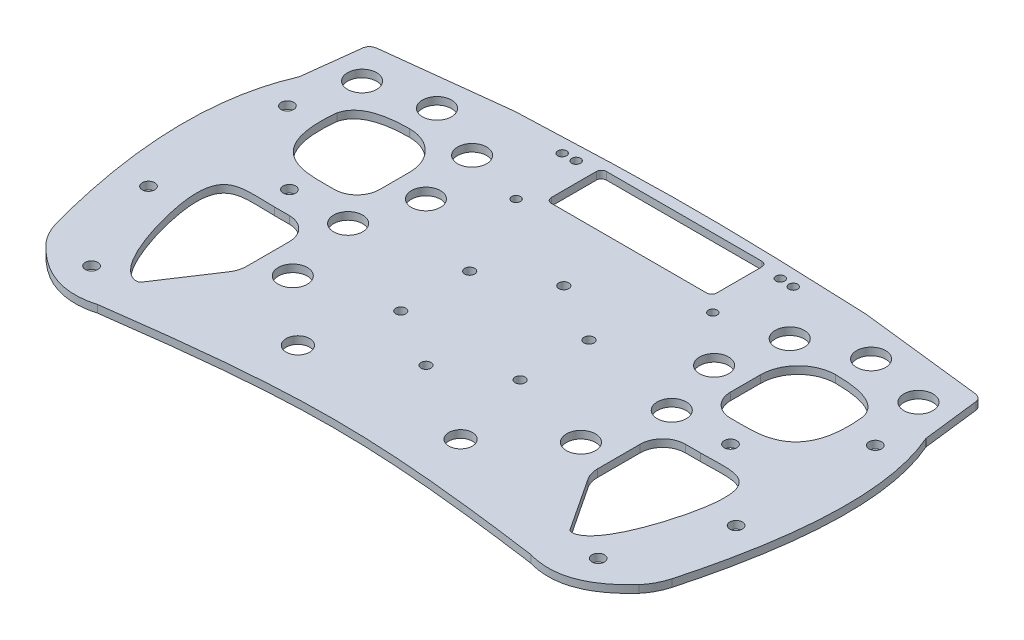
from build123d import *

# Parameters (mm, degrees)
BOSS_EXTRUDE1_OUTLINE_R   = 2.5
BOSS_EXTRUDE1_OUTLINE_R_2 = 4.7
BOSS_EXTRUDE1_OUTLINE_R_3 = 5.8
BOSS_EXTRUDE1_OUTLINE_R_4 = 2
BOSS_EXTRUDE1_DEPTH       = 3
SKETCH3_R                 = 1.5
CUT_EXTRUDE1_DEPTH        = 2
SKETCH5_W                 = 62
SKETCH5_H                 = 18
SKETCH5_W_2               = 2
SKETCH5_H_2               = 2
CUT_EXTRUDE4_DEPTH        = 3
SKETCH6_R                 = 1.75
CUT_EXTRUDE5_DEPTH        = 3


# Read off the part's stored shape, not the designer's step: Boss-Extrude1
with BuildPart() as part:
    # Boss-Extrude1 outline → Boss-Extrude1 (new body)
    with BuildSketch(Plane(origin=(0, 0, 0), x_dir=(1, 0, 0), z_dir=(0, 1, 0))):
        with BuildLine():
            Line((-70, 78), (-119.123426788, 72.331912294))
            add(Edge.make_bspline(
                [(-119.123426788, 72.331912294), (-121.817313074, 72.000000019), (-122.273896674, 69.717527721)],
                knots=[0.016356922, 0.016356922, 0.016356922, 0.873306336, 0.873306336, 0.873306336], degree=2))
            Line((-122.273896674, 69.717527721), (-125, 47))
            add(Edge.make_bspline(
                [(-125, 47), (-140.310843166, 12.049240253), (-122.843906966, -52.183993971)],
                knots=[0, 0, 0, 0.96415889, 0.96415889, 0.96415889], degree=2))
            add(Edge.make_bspline(
                [(-122.843906966, -52.183993971), (-121.5, -57), (-118.282004102, -60.826813609)],
                knots=[0, 0, 0, 1, 1, 1], degree=2))
            add(Edge.make_bspline(
                [(-118.282004102, -60.826813609), (-103.606996493, -76.952025301), (-86.5, -72)],
                knots=[0.099631764, 0.099631764, 0.099631764, 1, 1, 1], degree=2))
            add(Edge.make_bspline(
                [(-86.5, -72), (0, -60), (86.5, -72)],
                knots=[0, 0, 0, 1, 1, 1], degree=2, weights=[1, 1.666666667, 1]))
            add(Edge.make_bspline(
                [(118.282004106, -60.826813605), (103.606996495, -76.952025301), (86.5, -72)],
                knots=[0.099631763, 0.099631763, 0.099631763, 1, 1, 1], degree=2))
            add(Edge.make_bspline(
                [(122.843906966, -52.183993971), (121.5, -57), (118.282004106, -60.826813605)],
                knots=[0, 0, 0, 1, 1, 1], degree=2))
            add(Edge.make_bspline(
                [(125, 47), (140.310843171, 12.049240242), (122.843906966, -52.183993971)],
                knots=[0, 0, 0, 0.96415889, 0.96415889, 0.96415889], degree=2))
            Line((125, 47), (122.273896674, 69.717527721))
            add(Edge.make_bspline(
                [(119.123426788, 72.331912294), (121.817313074, 72.000000019), (122.273896674, 69.717527721)],
                knots=[0.016356922, 0.016356922, 0.016356922, 0.873306336, 0.873306336, 0.873306336], degree=2))
            Line((119.123426788, 72.331912294), (70, 78))
            add(Edge.make_bspline(
                [(-70, 78), (0, 81), (70, 78)],
                knots=[0, 0, 0, 1, 1, 1], degree=2, weights=[1, 1.857142857, 1]))
        make_face()
        with Locations((-101.086868344, -59.874042945)):
            Circle(BOSS_EXTRUDE1_OUTLINE_R, mode=Mode.SUBTRACT)
        with Locations((-32.460031949, -46.153127094)):
            Circle(BOSS_EXTRUDE1_OUTLINE_R_2, mode=Mode.SUBTRACT)
        with Locations((-117.25, -21)):
            Circle(BOSS_EXTRUDE1_OUTLINE_R, mode=Mode.SUBTRACT)
        with BuildLine():
            Line((-70, -12), (-70, -29))
            add(Edge.make_bspline(
                [(-70, -29), (-70, -31.999987298), (-71.652526625, -34.50382822)],
                knots=[0, 0, 0, 1, 1, 1], degree=2))
            Line((-71.652526625, -34.50382822), (-85.673736688, -55.74808589))
            add(Edge.make_bspline(
                [(-85, -3), (-99, -3), (-112, 0), (-108, -8.5), (-105, -31), (-98, -49), (-94.5, -57), (-86.500030089, -57), (-85.673736688, -55.74808589)],
                knots=[0, 0, 0, 0, 0, 0, 0, 0, 0, 1, 1, 1, 1, 1, 1, 1, 1, 1], degree=8))
            Line((-85, -3), (-79, -3))
            ThreePointArc((-79, -3), (-72.636038969, -5.636038969), (-70, -12))
        make_face(mode=Mode.SUBTRACT)
        with Locations((-57.5, -23.153127094)):
            Circle(BOSS_EXTRUDE1_OUTLINE_R_3, mode=Mode.SUBTRACT)
        with Locations((0, -27.5)):
            Circle(BOSS_EXTRUDE1_OUTLINE_R_4, mode=Mode.SUBTRACT)
        with Locations((-23.815698604, -13.75)):
            Circle(BOSS_EXTRUDE1_OUTLINE_R_4, mode=Mode.SUBTRACT)
        with Locations((32.460031949, -46.153127094)):
            Circle(BOSS_EXTRUDE1_OUTLINE_R_2, mode=Mode.SUBTRACT)
        with Locations((101.086868344, -59.874042945)):
            Circle(BOSS_EXTRUDE1_OUTLINE_R, mode=Mode.SUBTRACT)
        with Locations((57.5, -23.153127094)):
            Circle(BOSS_EXTRUDE1_OUTLINE_R_3, mode=Mode.SUBTRACT)
        with Locations((23.815698604, -13.75)):
            Circle(BOSS_EXTRUDE1_OUTLINE_R_4, mode=Mode.SUBTRACT)
        with BuildLine():
            add(Edge.make_bspline(
                [(85, -3), (99, -3), (112, 0), (108, -8.5), (105, -31), (98, -49), (94.5, -57), (86.500030089, -57), (85.673736688, -55.74808589)],
                knots=[0, 0, 0, 0, 0, 0, 0, 0, 0, 1, 1, 1, 1, 1, 1, 1, 1, 1], degree=8))
            Line((85.673736688, -55.74808589), (71.652526625, -34.50382822))
            add(Edge.make_bspline(
                [(70, -29), (70, -31.999987298), (71.652526625, -34.50382822)],
                knots=[0, 0, 0, 1, 1, 1], degree=2))
            Line((70, -29), (70, -12))
            ThreePointArc((70, -12), (72.636038969, -5.636038969), (79, -3))
            Line((79, -3), (85, -3))
        make_face(mode=Mode.SUBTRACT)
        with Locations((117.25, -21)):
            Circle(BOSS_EXTRUDE1_OUTLINE_R, mode=Mode.SUBTRACT)
        with Locations((-88, 6)):
            Circle(BOSS_EXTRUDE1_OUTLINE_R, mode=Mode.SUBTRACT)
        with Locations((-117.3, 34.5)):
            Circle(BOSS_EXTRUDE1_OUTLINE_R, mode=Mode.SUBTRACT)
        with BuildLine():
            add(Edge.make_bspline(
                [(-105, 42), (-108, 15), (-92, 15), (-83.5, 15)],
                knots=[0, 0, 0, 0, 1, 1, 1, 1], degree=3))
            add(Edge.make_bspline(
                [(-85, 51), (-102.75, 51), (-105, 42)],
                knots=[0, 0, 0, 1, 1, 1], degree=2))
            ThreePointArc((-85, 51), (-74.393398282, 46.606601718), (-70, 36))
            Line((-70, 36), (-70, 24))
            ThreePointArc((-70, 24), (-72.636038969, 17.636038969), (-79, 15))
            Line((-79, 15), (-83.5, 15))
        make_face(mode=Mode.SUBTRACT)
        with Locations((-64.577794898, 6)):
            Circle(BOSS_EXTRUDE1_OUTLINE_R_3, mode=Mode.SUBTRACT)
        with Locations((-23.815698604, 13.75)):
            Circle(BOSS_EXTRUDE1_OUTLINE_R_4, mode=Mode.SUBTRACT)
        with Locations((-57.5, 29.977172881)):
            Circle(BOSS_EXTRUDE1_OUTLINE_R_3, mode=Mode.SUBTRACT)
        with Locations((0, 27.5)):
            Circle(BOSS_EXTRUDE1_OUTLINE_R_4, mode=Mode.SUBTRACT)
        with Locations((-111, 58)):
            Circle(BOSS_EXTRUDE1_OUTLINE_R_3, mode=Mode.SUBTRACT)
        with Locations((-86.612529585, 63.500116978)):
            Circle(BOSS_EXTRUDE1_OUTLINE_R_3, mode=Mode.SUBTRACT)
        with Locations((-63.376133298, 54.276783114)):
            Circle(BOSS_EXTRUDE1_OUTLINE_R_3, mode=Mode.SUBTRACT)
        with Locations((-31, 55.5)):
            Circle(BOSS_EXTRUDE1_OUTLINE_R_4, mode=Mode.SUBTRACT)
        with Locations((-31, 73.5)):
            Circle(BOSS_EXTRUDE1_OUTLINE_R_4, mode=Mode.SUBTRACT)
        with Locations((23.815698604, 13.75)):
            Circle(BOSS_EXTRUDE1_OUTLINE_R_4, mode=Mode.SUBTRACT)
        with Locations((64.577794898, 6)):
            Circle(BOSS_EXTRUDE1_OUTLINE_R_3, mode=Mode.SUBTRACT)
        with Locations((57.5, 29.977172881)):
            Circle(BOSS_EXTRUDE1_OUTLINE_R_3, mode=Mode.SUBTRACT)
        with Locations((88, 6)):
            Circle(BOSS_EXTRUDE1_OUTLINE_R, mode=Mode.SUBTRACT)
        with BuildLine():
            ThreePointArc((70, 36), (74.393398282, 46.606601718), (85, 51))
            add(Edge.make_bspline(
                [(85, 51), (102.75, 51), (105, 42)],
                knots=[0, 0, 0, 1, 1, 1], degree=2))
            add(Edge.make_bspline(
                [(105, 42), (108, 15), (92, 15), (83.5, 15)],
                knots=[0, 0, 0, 0, 1, 1, 1, 1], degree=3))
            Line((83.5, 15), (79, 15))
            ThreePointArc((79, 15), (72.636038969, 17.636038969), (70, 24))
            Line((70, 24), (70, 36))
        make_face(mode=Mode.SUBTRACT)
        with Locations((117.3, 34.5)):
            Circle(BOSS_EXTRUDE1_OUTLINE_R, mode=Mode.SUBTRACT)
        with Locations((31, 55.5)):
            Circle(BOSS_EXTRUDE1_OUTLINE_R_4, mode=Mode.SUBTRACT)
        with Locations((63.376133298, 54.276783114)):
            Circle(BOSS_EXTRUDE1_OUTLINE_R_3, mode=Mode.SUBTRACT)
        with Locations((31, 73.5)):
            Circle(BOSS_EXTRUDE1_OUTLINE_R_4, mode=Mode.SUBTRACT)
        with Locations((111, 58)):
            Circle(BOSS_EXTRUDE1_OUTLINE_R_3, mode=Mode.SUBTRACT)
        with Locations((86.612529585, 63.500116978)):
            Circle(BOSS_EXTRUDE1_OUTLINE_R_3, mode=Mode.SUBTRACT)
    extrude(amount=BOSS_EXTRUDE1_DEPTH)

    # Sketch3 → Cut-Extrude1 (cut)
    with BuildSketch(Plane.XZ):
        with Locations(Location((-25.085243816, 42.803127094, 0), (0, 0, 270))):
            Circle(SKETCH3_R)
        with Locations(Location((39.834820081, 42.803127094, 0), (0, 0, 270))):
            Circle(SKETCH3_R)
    extrude(amount=-CUT_EXTRUDE1_DEPTH, mode=Mode.SUBTRACT)

    # Sketch5 → Cut-Extrude4 (cut)
    with BuildSketch(Plane(origin=(0, 3, 0), x_dir=(1, 0, 0), z_dir=(0, 1, 0))):
        with Locations((0, 64.5)):
            Rectangle(SKETCH5_W, SKETCH5_H)
        with Locations((-32, 64.5)):
            Rectangle(SKETCH5_W_2, SKETCH5_H)
        with Locations((0, 74.5)):
            Rectangle(SKETCH5_W, SKETCH5_H_2)
        with Locations((0, 54.5)):
            Rectangle(SKETCH5_W, SKETCH5_H_2)
        with Locations((32, 64.5)):
            Rectangle(SKETCH5_W_2, SKETCH5_H)
    extrude(amount=-CUT_EXTRUDE4_DEPTH, mode=Mode.SUBTRACT)

    # Sketch6 → Cut-Extrude5 (cut)
    with BuildSketch(Plane(origin=(0, 3, 0), x_dir=(1, 0, 0), z_dir=(0, 1, 0))):
        with Locations(Location((-46.1, 72.949853444, 0), (0, 0, 270))):
            Circle(SKETCH6_R)
        with Locations(Location((-39.5, 47.95, 0), (0, 0, 270))):
            Circle(SKETCH6_R)
        with Locations(Location((39, 47.95, 0), (0, 0, 270))):
            Circle(SKETCH6_R)
        with Locations(Location((46.1, 72.949853444, 0), (0, 0, 270))):
            Circle(SKETCH6_R)
        with Locations(Location((-40.718373628, 73.152096314, 0), (0, 0, 270))):
            Circle(SKETCH6_R)
        with Locations(Location((40.718373628, 73.152096314, 0), (0, 0, 270))):
            Circle(SKETCH6_R)
    extrude(amount=-CUT_EXTRUDE5_DEPTH, mode=Mode.SUBTRACT)


solid = part.part
